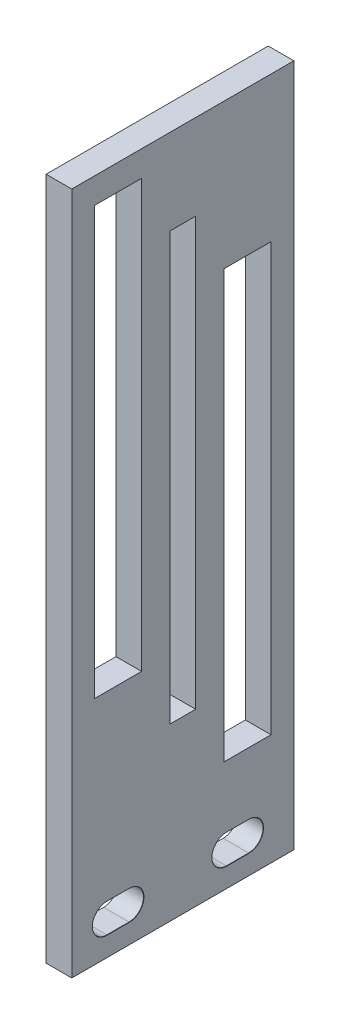
from build123d import *

# Parameters (mm, degrees)
SKETCH1_W                = 26
SKETCH1_H                = 80
BOSS_EXTRUDE1_DEPTH      = 3
SKETCH2_W                = 5.5
SKETCH2_H                = 50
SKETCH2_W_2              = 3
CUT_EXTRUDE1_DEPTH       = 3
M3_START                 = -1
M3_CLEARANCE_SLOT1_DEPTH = 5


with BuildPart() as part:
    # Sketch1 → Boss-Extrude1 (new body)
    with BuildSketch(Plane(origin=(0, 0, 0), x_dir=(0, 0, -1), z_dir=(1, 0, 0))):
        with Locations((13, 40)):
            Rectangle(SKETCH1_W, SKETCH1_H)
    extrude(amount=BOSS_EXTRUDE1_DEPTH)

    # Sketch2 → Cut-Extrude1 (cut)
    with BuildSketch(Plane(origin=(3, 0, 0), x_dir=(0, 0, -1), z_dir=(1, 0, 0))):
        with Locations((5.425, 52)):
            Rectangle(SKETCH2_W, SKETCH2_H)
        with Locations((13, 45)):
            Rectangle(SKETCH2_W_2, SKETCH2_H)
        with Locations((20.575, 38)):
            Rectangle(SKETCH2_W, SKETCH2_H)
    extrude(amount=-CUT_EXTRUDE1_DEPTH, mode=Mode.SUBTRACT)

    # M3 Clearance Slot1: read off the stored shape, not the designer's step
    # M3 Clearance Slot1 outline → M3 Clearance Slot1 (cut)
    with BuildSketch(Plane.YZ.offset(M3_START)):
        with BuildLine():
            Line((5.7, -20.725), (5.7, -18.125))
            ThreePointArc((5.7, -18.125), (4, -16.425), (2.3, -18.125))
            Line((2.3, -18.125), (2.3, -20.725))
            ThreePointArc((2.3, -20.725), (4, -22.425), (5.7, -20.725))
        make_face()
        with BuildLine():
            ThreePointArc((5.7, -4.125), (4, -2.425), (2.3, -4.125))
            Line((2.3, -4.125), (2.3, -6.725))
            ThreePointArc((2.3, -6.725), (4, -8.425), (5.7, -6.725))
            Line((5.7, -6.725), (5.7, -4.125))
        make_face()
    extrude(amount=M3_CLEARANCE_SLOT1_DEPTH, mode=Mode.SUBTRACT)

    # M3 Clearance Slot1 2: loft between two sections, ruled curve by curve
    m3_clearance_slot1_2_from = [
        Edge.make_three_point_arc((2.975, 5.7, -18.125), (2.975, 5.202081528, -16.922918472), (2.975, 4, -16.425)),
        Edge.make_three_point_arc((2.975, 4, -16.425), (2.975, 2.797918472, -16.922918472), (2.975, 2.3, -18.125)),
        Edge.make_three_point_arc((2.975, 2.3, -20.725), (2.975, 2.797918472, -21.927081528), (2.975, 4, -22.425)),
        Edge.make_three_point_arc((2.975, 4, -22.425), (2.975, 5.202081528, -21.927081528), (2.975, 5.7, -20.725)),
        Edge.make_line((2.975, 2.3, -18.125), (2.975, 2.3, -20.725)),
        Edge.make_line((2.975, 5.7, -18.125), (2.975, 5.7, -20.725)),
    ]
    m3_clearance_slot1_2_to = [
        Edge.make_three_point_arc((3, 5.725, -18.125), (3, 5.219759198, -16.905240802), (3, 4, -16.4)),
        Edge.make_three_point_arc((3, 4, -16.4), (3, 2.780240802, -16.905240802), (3, 2.275, -18.125)),
        Edge.make_three_point_arc((3, 2.275, -20.725), (3, 2.780240802, -21.944759198), (3, 4, -22.45)),
        Edge.make_three_point_arc((3, 4, -22.45), (3, 5.219759198, -21.944759198), (3, 5.725, -20.725)),
        Edge.make_line((3, 2.275, -18.125), (3, 2.275, -20.725)),
        Edge.make_line((3, 5.725, -18.125), (3, 5.725, -20.725)),
    ]
    m3_clearance_slot1_2 = Solid(Shell([*[Face.make_surface_from_curves(m3_clearance_slot1_2_from[k], m3_clearance_slot1_2_to[k]) for k in range(6)], Face(Wire(m3_clearance_slot1_2_from)), Face(Wire(m3_clearance_slot1_2_to))]))
    add(m3_clearance_slot1_2, mode=Mode.SUBTRACT)

    # M3 Clearance Slot1 3: loft between two sections, ruled curve by curve
    m3_clearance_slot1_3_from = [
        Edge.make_three_point_arc((2.975, 5.7, -4.125), (2.975, 5.202081528, -2.922918472), (2.975, 4, -2.425)),
        Edge.make_three_point_arc((2.975, 4, -2.425), (2.975, 2.797918472, -2.922918472), (2.975, 2.3, -4.125)),
        Edge.make_three_point_arc((2.975, 2.3, -6.725), (2.975, 2.797918472, -7.927081528), (2.975, 4, -8.425)),
        Edge.make_three_point_arc((2.975, 4, -8.425), (2.975, 5.202081528, -7.927081528), (2.975, 5.7, -6.725)),
        Edge.make_line((2.975, 2.3, -4.125), (2.975, 2.3, -6.725)),
        Edge.make_line((2.975, 5.7, -4.125), (2.975, 5.7, -6.725)),
    ]
    m3_clearance_slot1_3_to = [
        Edge.make_three_point_arc((3, 5.725, -4.125), (3, 5.219759198, -2.905240802), (3, 4, -2.4)),
        Edge.make_three_point_arc((3, 4, -2.4), (3, 2.780240802, -2.905240802), (3, 2.275, -4.125)),
        Edge.make_three_point_arc((3, 2.275, -6.725), (3, 2.780240802, -7.944759198), (3, 4, -8.45)),
        Edge.make_three_point_arc((3, 4, -8.45), (3, 5.219759198, -7.944759198), (3, 5.725, -6.725)),
        Edge.make_line((3, 2.275, -4.125), (3, 2.275, -6.725)),
        Edge.make_line((3, 5.725, -4.125), (3, 5.725, -6.725)),
    ]
    m3_clearance_slot1_3 = Solid(Shell([*[Face.make_surface_from_curves(m3_clearance_slot1_3_from[k], m3_clearance_slot1_3_to[k]) for k in range(6)], Face(Wire(m3_clearance_slot1_3_from)), Face(Wire(m3_clearance_slot1_3_to))]))
    add(m3_clearance_slot1_3, mode=Mode.SUBTRACT)


solid = part.part
